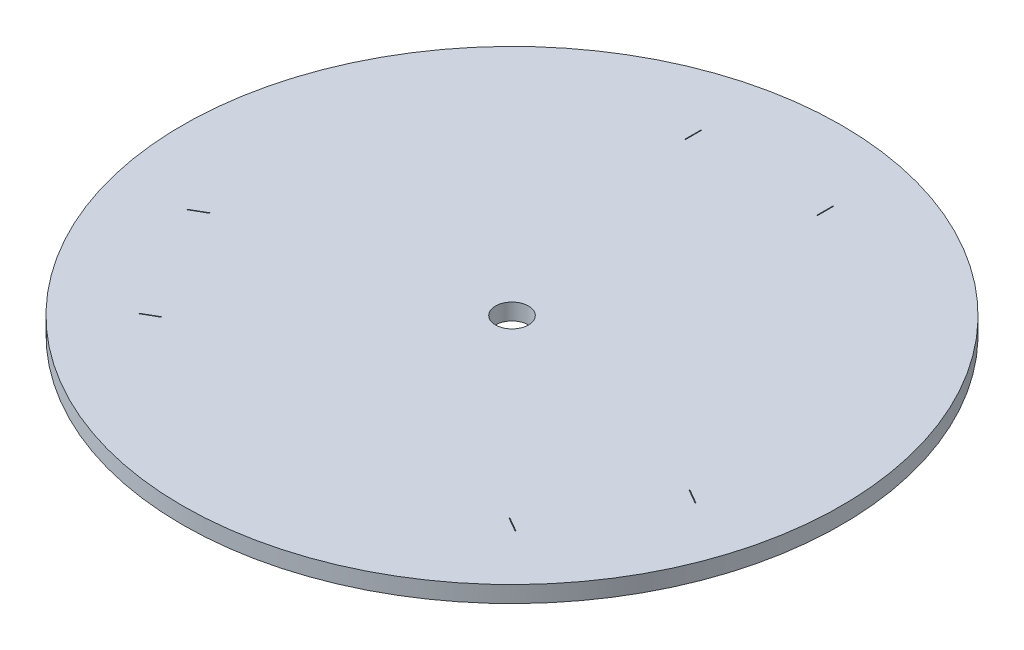
from build123d import *

# Parameters (mm, degrees)
SKETCH2_R           = 100
BOSS_EXTRUDE1_DEPTH = 5
SKETCH3_W           = 0.2
SKETCH3_H           = 5
CUT_EXTRUDE1_DEPTH  = 142.509716981


with BuildPart() as part:
    # Sketch2 → Boss-Extrude1 (new body)
    with BuildSketch(Plane(origin=(0, 0, 0), x_dir=(1, 0, 0), z_dir=(0, 1, 0))):
        Circle(SKETCH2_R)
    extrude(amount=BOSS_EXTRUDE1_DEPTH)

    # Sketch3 → Cut-Extrude1 (cut, through all)
    with BuildSketch(Plane(origin=(0, 5, 0), x_dir=(1, 0, 0), z_dir=(0, 1, 0))):
        Polygon((72.836841774, -18.842889384), (77.166968793, -21.342889384), (77.066968793, -21.516094465), (72.736841774, -19.016094465), align=None)
        with Locations((-20, 75)):
            Rectangle(SKETCH3_W, SKETCH3_H)
        with Locations((20, 75)):
            Rectangle(SKETCH3_W, SKETCH3_H)
        Polygon((52.836841774, -53.483905535), (57.166968793, -55.983905535), (57.066968793, -56.157110616), (52.736841774, -53.657110616), align=None)
        Polygon((-52.736841774, -53.657110616), (-57.066968793, -56.157110616), (-57.166968793, -55.983905535), (-52.836841774, -53.483905535), align=None)
        Polygon((-72.736841774, -19.016094465), (-77.066968793, -21.516094465), (-77.166968793, -21.342889384), (-72.836841774, -18.842889384), align=None)
    extrude(amount=-CUT_EXTRUDE1_DEPTH, mode=Mode.SUBTRACT)

    # Sketch7 → Ø10.0mm Dowel Hole1 (revolve, cut)
    with BuildSketch(Plane(origin=(0, 0, 0), x_dir=(0, 0, -1), z_dir=(1, 0, 0))):
        Polygon((0, 0), (0, 5), (5, 5), (5, 0.025), (5.025, 0), align=None)
    revolve(axis=Axis((0, -6.35, 0), (0, 1, 0)), mode=Mode.SUBTRACT)


solid = part.part
